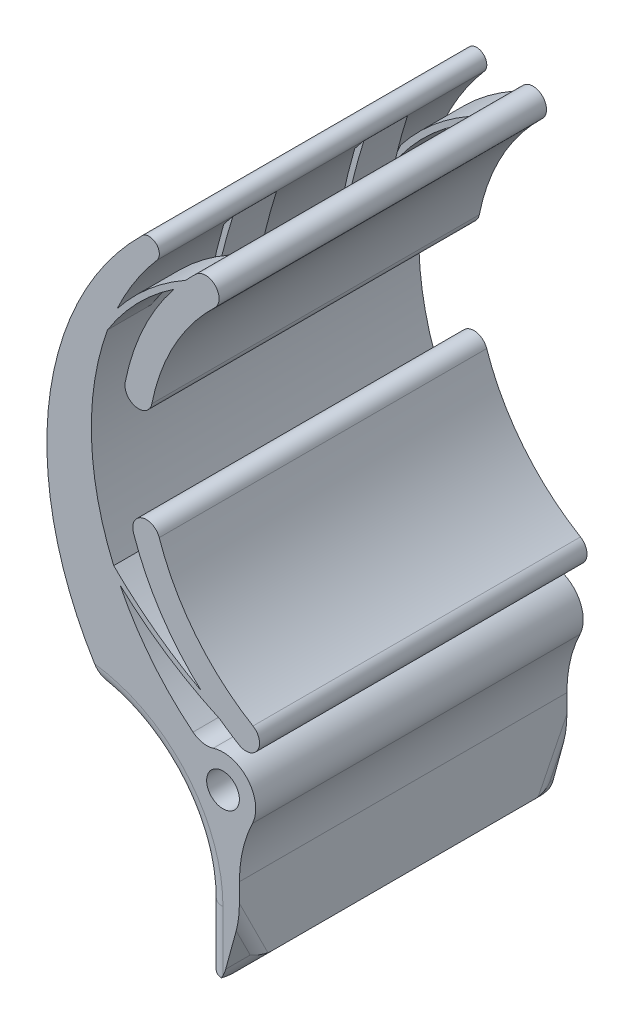
from build123d import *

# Parameters (mm, degrees)
SKETCH4_R             = 1.5
BOSS_EXTRUDE3_DEPTH   = 15
BOSS_EXTRUDE3_2_DEPTH = 15
BOSS_EXTRUDE3_3_DEPTH = 15
BOSS_EXTRUDE23_START  = 15
BOSS_EXTRUDE23_DEPTH  = 4
BOSS_EXTRUDE24_START  = 8
BOSS_EXTRUDE24_DEPTH  = 4
FILLET2_R             = 2
FILLET1_R             = 1.5


# Read off the part's stored shape, not the designer's step: Mirror15
with BuildPart() as part:
    # Sketch4 → Boss-Extrude3 (new, symmetric)
    with BuildSketch(Plane.XY):
        with BuildLine():
            ThreePointArc((-15.745615363, 108.217071894), (-14.863780591, 107.808507644), (-13.893474834, 107.863861505))
            ThreePointArc((-13.893474834, 107.863861505), (-10.727575159, 106.958592694), (-10.299299114, 103.693778456))
            ThreePointArc((-10.299299114, 103.693778456), (-11.193367854, 101.14903756), (-11.496495568, 98.468892279))
            Line((-11.496495568, 98.468892279), (-11.496495568, 91.5))
            Line((-11.496495568, 91.5), (-13, 90))
            Line((-13, 90), (-14.503504432, 90))
            Line((-14.503504432, 90), (-14.503504432, 95.734709942))
            ThreePointArc((-14.503504432, 95.734709942), (-17.04172216, 103.115406131), (-23.582617138, 107.373800002))
            ThreePointArc((-23.582617138, 107.373800002), (-29.032421023, 126.907705171), (-20.414545428, 145.265429262))
            ThreePointArc((-20.414545428, 145.265429262), (-19.127581616, 145.281958408), (-19.054880744, 143.996943368))
            ThreePointArc((-19.054880744, 143.996943368), (-24.95633052, 125.408148717), (-15.745615363, 108.217071894))
        make_face()
        with Locations((-13, 105)):
            Circle(SKETCH4_R, mode=Mode.SUBTRACT)
    extrude(amount=BOSS_EXTRUDE3_DEPTH, both=True)



with BuildPart() as body_2:
    # Sketch4 → Boss-Extrude3 2 (new, symmetric)
    with BuildSketch(Plane.XY):
        with BuildLine():
            ThreePointArc((-15.463298435, 144.692144482), (-19.624699769, 139.278232713), (-21.960734627, 132.861797344))
            ThreePointArc((-21.960734627, 132.861797344), (-20.98224362, 131.398279383), (-19.518725659, 132.37677039))
            ThreePointArc((-19.518725659, 132.37677039), (-17.442455247, 138.079705369), (-13.743797057, 142.891596244))
            ThreePointArc((-13.743797057, 142.891596244), (-13.703273627, 144.651621052), (-15.463298435, 144.692144482))
        make_face()
    extrude(amount=BOSS_EXTRUDE3_2_DEPTH, both=True)


with BuildPart() as body_3:
    # Sketch4 → Boss-Extrude3 3 (new, symmetric)
    with BuildSketch(Plane.XY):
        with BuildLine():
            ThreePointArc((-18.842097465, 122.098018813), (-15.492555186, 116.010374953), (-10.254266127, 111.445381089))
            ThreePointArc((-10.254266127, 111.445381089), (-9.828866365, 109.737058954), (-11.5371885, 109.311659193))
            ThreePointArc((-11.5371885, 109.311659193), (-17.430845593, 114.447784397), (-21.199452745, 121.297059992))
            ThreePointArc((-21.199452745, 121.297059992), (-20.421254515, 122.876217042), (-18.842097465, 122.098018813))
        make_face()
    extrude(amount=BOSS_EXTRUDE3_3_DEPTH, both=True)


with BuildPart() as part_1:
    add(part.part)

    add(body_2.part)  # Boss-Extrude23 merges body 2

    add(body_3.part)  # Boss-Extrude23 merges body 3
    # Sketch81 → Boss-Extrude23 (add)
    with BuildSketch(Plane.XY.offset(BOSS_EXTRUDE23_START)):
        with BuildLine():
            ThreePointArc((-16.40923932, 143.732728133), (-16.959334589, 143.117801193), (-17.486399904, 142.483023987))
            ThreePointArc((-17.486399904, 142.483023987), (-20.86751312, 139.665952099), (-23.582500348, 136.202331891))
            ThreePointArc((-23.582500348, 136.202331891), (-23.172403472, 137.265482274), (-22.71440592, 138.308893232))
            ThreePointArc((-22.71440592, 138.308893232), (-19.828313947, 141.330604813), (-16.40923932, 143.732728133))
        make_face()
        with BuildLine():
            ThreePointArc((-14.984055873, 111.863377416), (-19.218265584, 114.528225057), (-23.012819409, 117.788793427))
            ThreePointArc((-23.012819409, 117.788793427), (-22.730989821, 117.159440449), (-22.431952643, 116.538079158))
            ThreePointArc((-22.431952643, 116.538079158), (-18.094842505, 113.132119318), (-13.268041623, 110.465083507))
            ThreePointArc((-13.268041623, 110.465083507), (-14.143339764, 111.14301058), (-14.984055873, 111.863377416))
        make_face()
    extrude(amount=-BOSS_EXTRUDE23_DEPTH)

    # Sketch81<4> → Boss-Extrude24 (add)
    with BuildSketch(Plane.XY.offset(BOSS_EXTRUDE24_START)):
        with BuildLine():
            ThreePointArc((-20.65110959, 119.849519429), (-20.27231766, 118.99567056), (-19.858240545, 118.158364546))
            ThreePointArc((-19.858240545, 118.158364546), (-18.627716165, 113.52909009), (-16.787605108, 109.106606226))
            ThreePointArc((-16.787605108, 109.106606226), (-17.300236642, 109.582181696), (-17.799401283, 110.071873209))
            ThreePointArc((-17.799401283, 110.071873209), (-19.571385864, 114.859745334), (-20.65110959, 119.849519429))
        make_face()
        with BuildLine():
            ThreePointArc((-19.934917917, 142.906651174), (-21.099885834, 138.172303965), (-21.85680447, 133.355845939))
            ThreePointArc((-21.85680447, 133.355845939), (-21.435815653, 134.965674653), (-20.896432339, 136.539792094))
            ThreePointArc((-20.896432339, 136.539792094), (-20.121005018, 140.27470116), (-19.095815217, 143.948911161))
            ThreePointArc((-19.095815217, 143.948911161), (-19.522323343, 143.433381929), (-19.934917917, 142.906651174))
        make_face()
    extrude(amount=-BOSS_EXTRUDE24_DEPTH)

    # SurfaceCut2: cut with a surface, the side it looks to stays
    # 3DSketch1 → Surface-Fill1: a flat surface bounded by the sketch
    with BuildSketch(Plane(origin=(-13, 90, 15), x_dir=(0.2636894274940136, 0.964607633096421, 0), z_dir=(-0.8532247447444736, 0.2332413063570551, -0.4664826127141099)), mode=Mode.PRIVATE) as surface_fill1_1_region:
        Polygon((0, 0), (5.701800205, 0), (1.843369672, 2.261086868), align=None)
    surface_fill1_1 = surface_fill1_1_region.sketch.faces()[0]
    split(bisect_by=surface_fill1_1, keep=Keep.TOP)

    # Fillet2
    fillet2_edges = [part_1.edges().sort_by_distance(p)[0] for p in [
        (-11.496495568, 93.5, 14),
        (-12.248247784, 90.75, 14),
    ]]
    fillet(fillet2_edges, radius=FILLET2_R)

    # Fillet1
    # the kernel refuses this fillet: 1.5 mm, written as the material it takes off along each edge
    with BuildSketch(Plane(origin=(-14.503504432, 86.25, 15), x_dir=(1, 0, 0), z_dir=(0, 1, 0)), Plane(origin=(-14.503504432, 86.25, -15), x_dir=(0, 0, 1), z_dir=(0, 1, 0))) as fillet1_piece_1:
        with BuildLine():
            CenterArc((FILLET1_R, FILLET1_R), FILLET1_R, 180, 90)
            Line((0, FILLET1_R), (0, 0))
            Line((0, 0), (FILLET1_R, 0))
        make_face()
    extrude(amount=9.484709942, mode=Mode.SUBTRACT)
    with BuildSketch(Plane(origin=(-26.503504432, 95.734709942, 15), x_dir=(1, 0, 0), z_dir=(0, -1, 0))) as fillet1_piece_2:
        with BuildLine():
            CenterArc((12 + FILLET1_R, -FILLET1_R), FILLET1_R, 90, 90)
            Line((12, -FILLET1_R), (12, 0))
            Line((12, 0), (12 + FILLET1_R, 0))
        make_face()
    revolve(axis=Axis((-26.503504432, 95.734709942, 15), (0, 0, 1)), revolution_arc=93.822319642, mode=Mode.SUBTRACT)
    with BuildSketch(Plane(origin=(-26.503504432, 95.734709942, -15), x_dir=(1, 0, 0), z_dir=(0, -1, 0))) as fillet1_piece_3:
        with BuildLine():
            CenterArc((12 + FILLET1_R, FILLET1_R), FILLET1_R, 180, 90)
            Line((12 + FILLET1_R, 0), (12, 0))
            Line((12, 0), (12, FILLET1_R))
        make_face()
    revolve(axis=Axis((-26.503504432, 95.734709942, -15), (0, 0, 1)), revolution_arc=93.822319642, mode=Mode.SUBTRACT)

    # Mirror15
    split(bisect_by=Plane.XY, keep=Keep.TOP)

    # Mirror15 2: part across plane


with BuildPart() as part_2:
    add(part_1.part)
    add(part_1.part.mirror(Plane.XY))


solid = part_2.part
